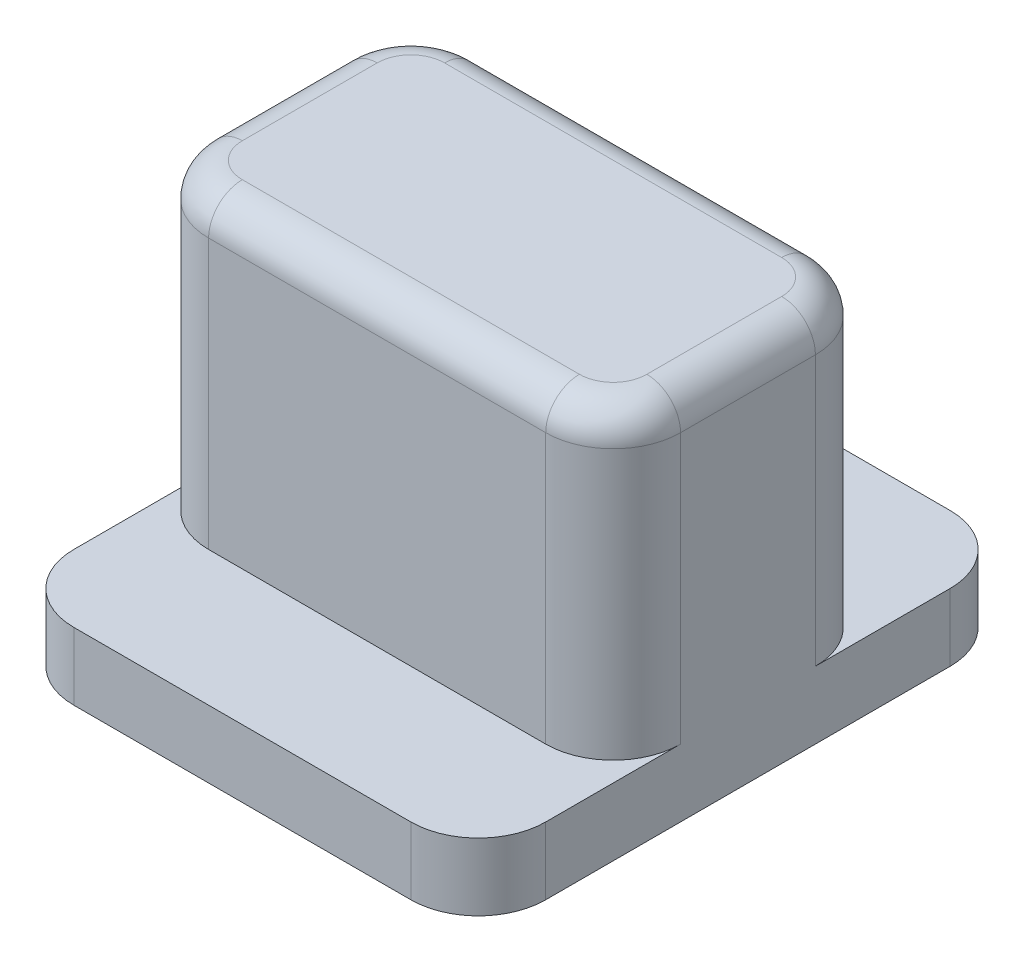
from build123d import *

# Parameters (mm, degrees)
SKETCH_1_W      = 7
SKETCH_1_H      = 8
EXTRUDE_1_DEPTH = 1
EXTRUDE_2_DEPTH = 4.5
FILLET_1_R      = 1
FILLET_2_R      = 0.5


with BuildPart() as part:
    # 草图1 → 凸台-拉伸1 (new body)
    with BuildSketch(Plane(origin=(0, 0, 0), x_dir=(1, 0, 0), z_dir=(0, 1, 0))):
        with Locations((30.052937772, 4.5)):
            Rectangle(SKETCH_1_W, SKETCH_1_H)
    extrude(amount=EXTRUDE_1_DEPTH)

    # 草图2 → 凸台-拉伸2 (add)
    with BuildSketch(Plane(origin=(0, 1, 0), x_dir=(1, 0, 0), z_dir=(0, 1, 0))):
        Polygon((26.552937772, 4.5), (26.552937772, 6.5), (33.552937772, 6.5), (33.552937772, 2.5), (26.552937772, 2.5), align=None)
    extrude(amount=EXTRUDE_2_DEPTH)

    # 圆角1
    fillet_1_edges = [part.edges().sort_by_distance(p)[0] for p in [
        (26.552937772, 0.5, -8.5),
        (26.552937772, 3.25, -6.5),
        (26.552937772, 3.25, -2.5),
        (33.552937772, 3.25, -2.5),
        (33.552937772, 3.25, -6.5),
        (33.552937772, 0.5, -8.5),
        (26.552937772, 0.5, -0.5),
        (33.552937772, 0.5, -0.5),
    ]]
    fillet(fillet_1_edges, radius=FILLET_1_R)

    # 圆角2
    fillet_2_edges = [part.edges().sort_by_distance(p)[0] for p in [
        (33.260044553, 5.5, -6.207106781),
        (33.552937772, 5.5, -4.5),
        (33.260044553, 5.5, -2.792893219),
        (30.052937772, 5.5, -2.5),
        (26.84583099, 5.5, -2.792893219),
        (26.552937772, 5.5, -4.5),
        (26.84583099, 5.5, -6.207106781),
        (30.052937772, 5.5, -6.5),
    ]]
    fillet(fillet_2_edges, radius=FILLET_2_R)


solid = part.part
